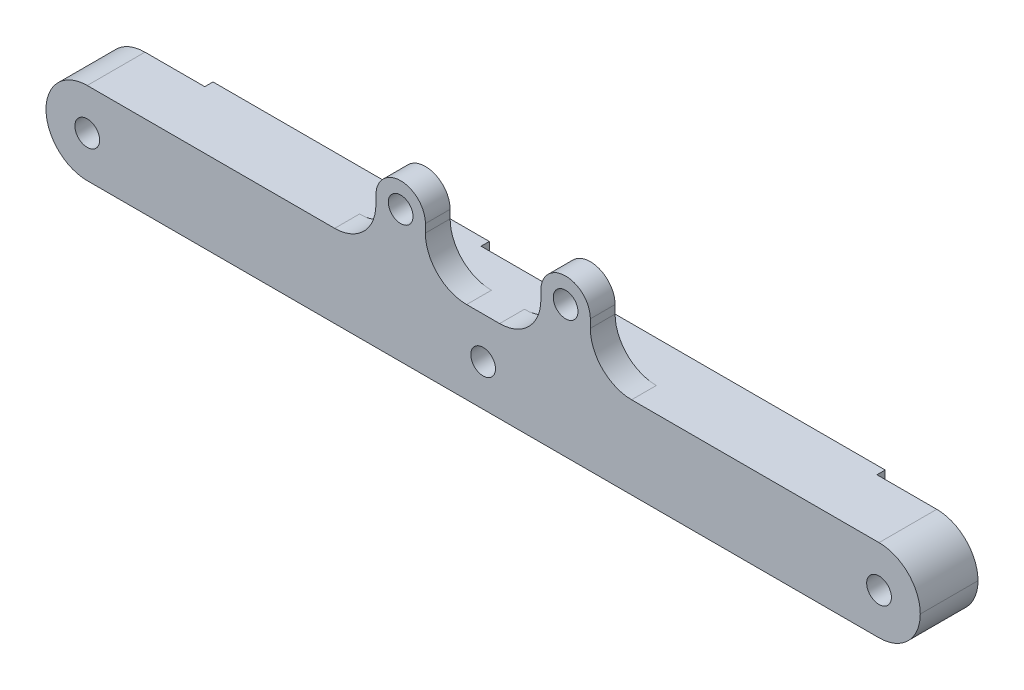
from build123d import *

# Parameters (mm, degrees)
SKETCH1_W           = 106
SKETCH1_H           = 10
BOSS_EXTRUDE1_DEPTH = 7
FILLET1_R           = 5
SKETCH2_R           = 1.5
CUT_EXTRUDE1_DEPTH  = 54.693575035
SKETCH3_R           = 1.5
BOSS_EXTRUDE2_DEPTH = 3
FILLET2_R           = 5
FILLET3_R           = 5
FILLET4_R           = 5
SKETCH4_W           = 33.5
SKETCH4_H           = 10
BOSS_EXTRUDE3_DEPTH = 1


with BuildPart() as part:
    # Sketch1 → Boss-Extrude1 (new body)
    with BuildSketch(Plane.XY):
        Rectangle(SKETCH1_W, SKETCH1_H)
    extrude(amount=BOSS_EXTRUDE1_DEPTH)

    # Fillet1
    fillet1_edges = [part.edges().sort_by_distance(p)[0] for p in [
        (-53, -5, 3.5),
        (53, -5, 3.5),
        (53, 5, 3.5),
        (-53, 5, 3.5),
    ]]
    fillet(fillet1_edges, radius=FILLET1_R - 0.0001)  # a hair under: the kernel refuses the full size

    # Sketch2 → Cut-Extrude1 (cut, through all)
    with BuildSketch(Plane.XY.offset(7)):
        with Locations((-48, 0)):
            Circle(SKETCH2_R)
        with Locations((48, 0)):
            Circle(SKETCH2_R)
        Circle(SKETCH2_R)
    extrude(amount=-CUT_EXTRUDE1_DEPTH, mode=Mode.SUBTRACT)

    # Sketch3 → Boss-Extrude2 (add)
    # profile 1 of 2: a face of its own
    with BuildSketch(Plane.XY.offset(7)):
        with BuildLine():
            Line((7, 11), (7, 5))
            Line((7, 5), (13, 5))
            Line((13, 5), (13, 11))
            ThreePointArc((13, 11), (10, 14), (7, 11))
        make_face()
        with Locations((10, 11)):
            Circle(SKETCH3_R, mode=Mode.SUBTRACT)
    # profile 2 of 2: a face of its own
    with BuildSketch(Plane.XY.offset(7)):
        with BuildLine():
            Line((-7, 11), (-7, 5))
            Line((-7, 5), (-13, 5))
            Line((-13, 5), (-13, 11))
            ThreePointArc((-13, 11), (-10, 14), (-7, 11))
        make_face()
        with Locations((-10, 11)):
            Circle(SKETCH3_R, mode=Mode.SUBTRACT)
    extrude(amount=-BOSS_EXTRUDE2_DEPTH)

    # Fillet2
    fillet2_edges = [part.edges().sort_by_distance(p)[0] for p in [
        (-13, 5, 5.5),
    ]]
    fillet(fillet2_edges, radius=FILLET2_R)

    # Fillet3
    fillet3_edges = [part.edges().sort_by_distance(p)[0] for p in [
        (7, 5, 5.5),
        (-7, 5, 5.5),
    ]]
    fillet(fillet3_edges, radius=FILLET3_R)

    # Fillet4
    fillet4_edges = [part.edges().sort_by_distance(p)[0] for p in [
        (13, 5, 5.5),
    ]]
    fillet(fillet4_edges, radius=FILLET4_R)

    # Sketch4 → Boss-Extrude3 (add)
    with BuildSketch(Plane(origin=(0, 0, 0), x_dir=(-1, 0, 0), z_dir=(0, 0, -1))):
        with Locations((-24, 0)):
            Rectangle(SKETCH4_W, SKETCH4_H)
        with Locations((24, 0)):
            Rectangle(SKETCH4_W, SKETCH4_H)
    extrude(amount=BOSS_EXTRUDE3_DEPTH)


solid = part.part
